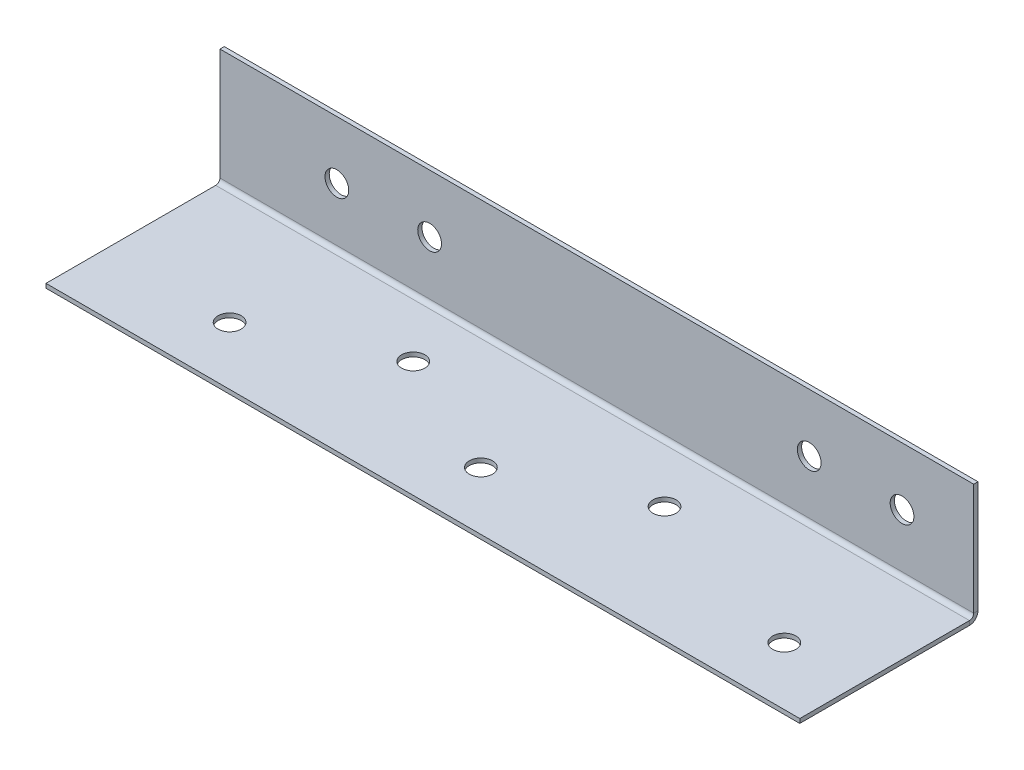
from build123d import *

# Parameters (mm, degrees)
SKETCH1_W                    = 130
SKETCH1_H                    = 30
SKETCH1_R                    = 2
BASE_FLANGE1_DEPTH           = 0.7366
EDGE_FLANGE1_STRIP_W         = 4.4196
EDGE_FLANGE1_STRIP_H         = 0.7366
EDGE_FLANGE1_STRIP_CUT_DEPTH = 130
EDGE_FLANGE1_DEPTH           = 130
SKETCH9_R                    = 2.05
CUT_EXTRUDE1_DEPTH           = 245.182063336


# Sheet-metal steps are written as plain solids
with BuildPart() as part:
    # Sketch1 → Base-Flange1 (new body)
    with BuildSketch(Plane(origin=(0, 0, 0), x_dir=(1, 0, 0), z_dir=(0, 1, 0))):
        Rectangle(SKETCH1_W, SKETCH1_H)
        with Locations(Location((0, -5, 0), (0, 0, 270))):
            Circle(SKETCH1_R, mode=Mode.SUBTRACT)
        with Locations(Location((-21.666666667, 5, 0), (0, 0, 270))):
            Circle(SKETCH1_R, mode=Mode.SUBTRACT)
        with Locations(Location((-43.333333333, -5, 0), (0, 0, 270))):
            Circle(SKETCH1_R, mode=Mode.SUBTRACT)
        with Locations(Location((52.33, -5, 0), (0, 0, 270))):
            Circle(SKETCH1_R, mode=Mode.SUBTRACT)
        with Locations(Location((21.67, 5, 0), (0, 0, 270))):
            Circle(SKETCH1_R, mode=Mode.SUBTRACT)
    extrude(amount=-BASE_FLANGE1_DEPTH)

    # Edge-Flange1 strip (across the edge) → Edge-Flange1 strip cut (cut)
    with BuildSketch(Plane(origin=(65, 0, -15), x_dir=(0, 0, 1), z_dir=(-1, 0, 0))):
        with Locations((-1.4732, -0.3683)):
            Rectangle(EDGE_FLANGE1_STRIP_W, EDGE_FLANGE1_STRIP_H)
    extrude(amount=EDGE_FLANGE1_STRIP_CUT_DEPTH, mode=Mode.SUBTRACT)

    # Edge-Flange1 section (across the edge) → Edge-Flange1 (add)
    with BuildSketch(Plane(origin=(65, 0, -15), x_dir=(0, 0, 1), z_dir=(-1, 0, 0))):
        with BuildLine():
            Line((-0.7366, 0.7366), (-0.7366, 20))
            Line((-0.7366, 20), (0, 20))
            Line((0, 20), (0, 0.7366))
            ThreePointArc((0, 0.7366), (0.215745145, 0.215745145), (0.7366, 0))
            Line((0.7366, 0), (0.7366, -0.7366))
            ThreePointArc((0.7366, -0.7366), (-0.30510971, -0.30510971), (-0.7366, 0.7366))
        make_face()
    extrude(amount=EDGE_FLANGE1_DEPTH)

    # Sketch9 → Cut-Extrude1 (cut, through all)
    with BuildSketch(Plane(origin=(-5.975935003, -11.740421973, -216.4732), x_dir=(-1, 0, 0), z_dir=(0, 0, -1))):
        with Locations(Location((-42.610472437, 21.740421973, 0), (0, 0, 270))):
            Circle(SKETCH9_R)
        with Locations(Location((-58.610472437, 21.740421973, 0), (0, 0, 270))):
            Circle(SKETCH9_R)
        with Locations(Location((22.862727563, 21.740421973, 0), (0, 0, 270))):
            Circle(SKETCH9_R)
        with Locations(Location((38.862727563, 21.740421973, 0), (0, 0, 270))):
            Circle(SKETCH9_R)
    extrude(amount=-CUT_EXTRUDE1_DEPTH, mode=Mode.SUBTRACT)


solid = part.part
